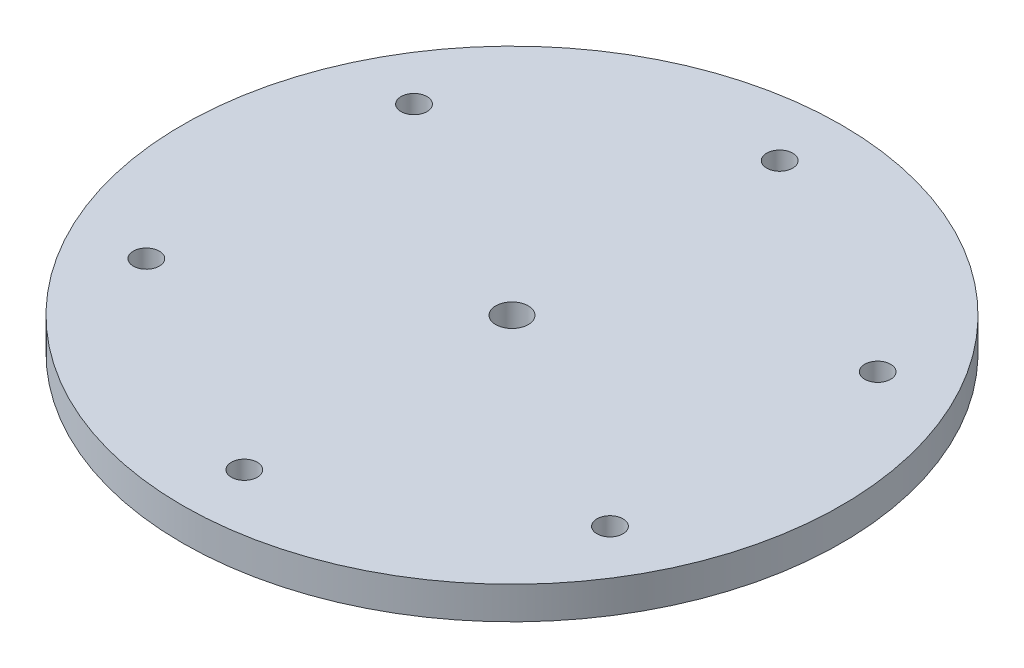
from build123d import *

# Parameters (mm, degrees)
SKETCH3_R          = 4
CUT_EXTRUDE1_DEPTH = 10
SKETCH4_R          = 5
CUT_EXTRUDE2_DEPTH = 10


with BuildPart() as part:
    # Sketch2 → Revolve1 (revolve)
    with BuildSketch(Plane.XY):
        Polygon((0, -1), (-72.95, -1), (-72.95, 0), (-76.2, 0), (-76.2, -1), (-101.2, -1), (-101.2, 9), (0, 9), align=None)
    revolve(axis=Axis((0, 9, 0), (0, -1, 0)))

    # Sketch3 → Cut-Extrude1 (cut)
    with BuildSketch(Plane.XZ.offset(1)):
        with Locations((0, 82.2)):
            Circle(SKETCH3_R)
        with Locations((71.187288191, 41.1)):
            Circle(SKETCH3_R)
        with Locations((71.187288191, -41.1)):
            Circle(SKETCH3_R)
        with Locations((0, -82.2)):
            Circle(SKETCH3_R)
        with Locations((-71.187288191, -41.1)):
            Circle(SKETCH3_R)
        with Locations((-71.187288191, 41.1)):
            Circle(SKETCH3_R)
    extrude(amount=-CUT_EXTRUDE1_DEPTH, mode=Mode.SUBTRACT)

    # Sketch4 → Cut-Extrude2 (cut)
    with BuildSketch(Plane(origin=(0, 9, 0), x_dir=(1, 0, 0), z_dir=(0, 1, 0))):
        Circle(SKETCH4_R)
    extrude(amount=-CUT_EXTRUDE2_DEPTH, mode=Mode.SUBTRACT)


solid = part.part
